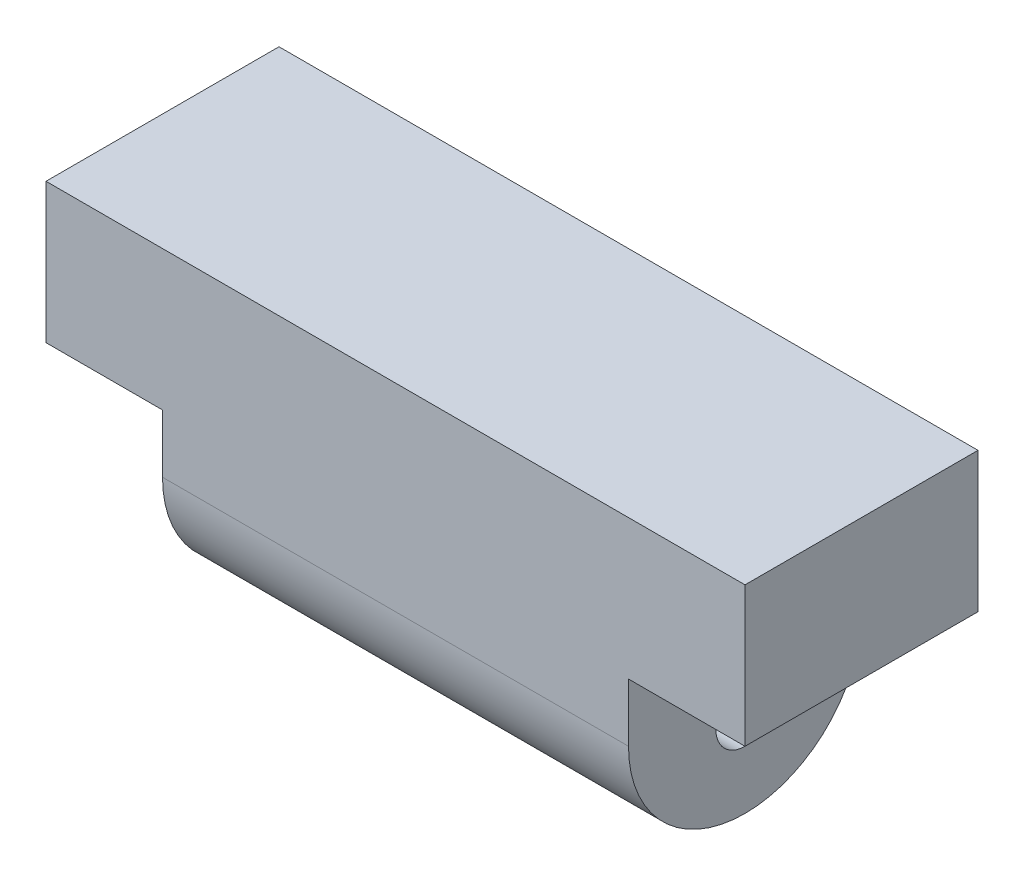
from build123d import *

# Parameters (mm, degrees)
BOSS_EXTRUDE1_DEPTH = 20
SKETCH2_R           = 2.5
CUT_EXTRUDE1_DEPTH  = 56.518015094
FILLET1_R           = 10


with BuildPart() as part:
    # Sketch1 → Boss-Extrude1 (new body)
    with BuildSketch(Plane.XY):
        Polygon((-30, 13.5), (30, 13.5), (30, 1.5), (20, 1.5), (20, -13.5), (-20, -13.5), (-20, 1.5), (-30, 1.5), align=None)
    extrude(amount=BOSS_EXTRUDE1_DEPTH)

    # Sketch2 → Cut-Extrude1 (cut, through all)
    with BuildSketch(Plane(origin=(20, 0, 0), x_dir=(0, 0, -1), z_dir=(1, 0, 0))):
        with Locations(Location((-10, -6, 0), (0, 0, 90))):
            Circle(SKETCH2_R)
    extrude(amount=-CUT_EXTRUDE1_DEPTH, mode=Mode.SUBTRACT)

    # Fillet1
    fillet1_edges = [part.edges().sort_by_distance(p)[0] for p in [
        (0, -13.5, 0),
        (0, -13.5, 20),
    ]]
    fillet(fillet1_edges, radius=FILLET1_R - 0.0001)  # a hair under: the kernel refuses the full size


solid = part.part
